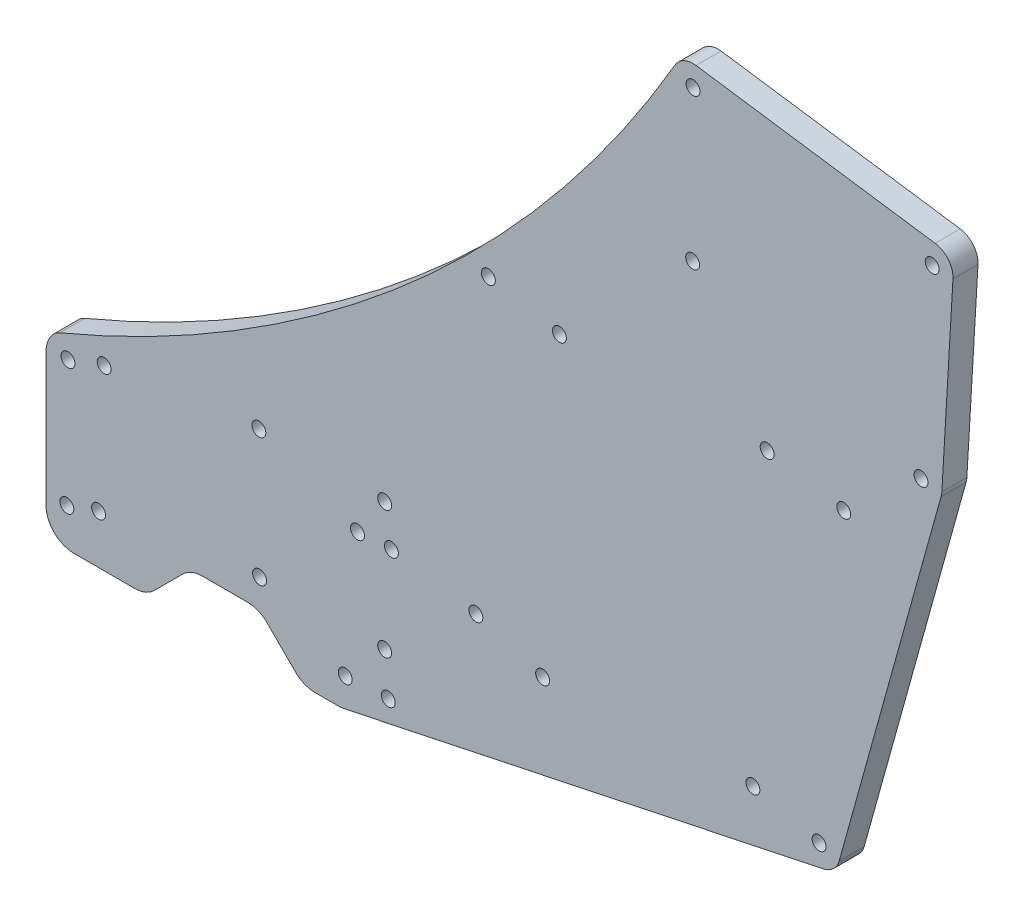
from build123d import *

# Parameters (mm, degrees)
SKETCH2_R           = 2.499965
SKETCH2_R_2         = 2.49997
SKETCH2_R_3         = 2.4999655
SKETCH2_R_4         = 2.499962807
SKETCH2_R_5         = 2.4999705
SKETCH2_R_6         = 2.499967809
SKETCH2_R_7         = 2.499966
SKETCH2_R_8         = 2.4999665
SKETCH2_R_9         = 2.499966488
BOSS_EXTRUDE1_DEPTH = 9
CUT_EXTRUDE1_DEPTH  = 10
CUT_EXTRUDE2_DEPTH  = 244.998875453
SKETCH5_R           = 2.5
CUT_EXTRUDE3_DEPTH  = 244.998875453
CUT_EXTRUDE5_DEPTH  = 10
FILLET1_R           = 10


with BuildPart() as part:
    # Sketch2 → Boss-Extrude1 (new body)
    with BuildSketch(Plane.XY):
        Polygon((-211.70586, -139.55845), (122.983766, -139.55845), (211.70583, 139.558464), (-211.70586, 139.558464), align=None)
        with Locations((-192.444718, -125.900476)):
            Circle(SKETCH2_R, mode=Mode.SUBTRACT)
        with Locations((-181.028235, -121.988219)):
            Circle(SKETCH2_R_2, mode=Mode.SUBTRACT)
        with Locations((-192.0409685, -80.3042345)):
            Circle(SKETCH2_R_3, mode=Mode.SUBTRACT)
        with Locations((-179.0281635, -75.623296193)):
            Circle(SKETCH2_R_4, mode=Mode.SUBTRACT)
        with Locations((-92.3000565, -128.9494755)):
            Circle(SKETCH2_R_5, mode=Mode.SUBTRACT)
        with Locations((-76.832143809, -128.336904809)):
            Circle(SKETCH2_R_6, mode=Mode.SUBTRACT)
        with Locations((-87.928392809, -81.863553809)):
            Circle(SKETCH2_R_6, mode=Mode.SUBTRACT)
        with Locations((-75.718345809, -81.250965809)):
            Circle(SKETCH2_R_6, mode=Mode.SUBTRACT)
        with Locations((-45.325502, -86.123854)):
            Circle(SKETCH2_R, mode=Mode.SUBTRACT)
        with Locations((-21.323083, -93.781229)):
            Circle(SKETCH2_R_7, mode=Mode.SUBTRACT)
        with Locations((54.304011, -89.994307)):
            Circle(SKETCH2_R_7, mode=Mode.SUBTRACT)
        with Locations((78.1115035, -95.7303835)):
            Circle(SKETCH2_R_8, mode=Mode.SUBTRACT)
        with Locations((114.776659, 36.09363)):
            Circle(SKETCH2_R, mode=Mode.SUBTRACT)
        with Locations((86.96623, 12.266557)):
            Circle(SKETCH2_R_7, mode=Mode.SUBTRACT)
        with Locations((59.4275, 17.097677)):
            Circle(SKETCH2_R, mode=Mode.SUBTRACT)
        with Locations((-40.842451, 21.163049)):
            Circle(SKETCH2_R, mode=Mode.SUBTRACT)
        with Locations((-15.2807135, 15.9838705)):
            Circle(SKETCH2_R_8, mode=Mode.SUBTRACT)
        with Locations((32.626661, 62.749598)):
            Circle(SKETCH2_R_7, mode=Mode.SUBTRACT)
        with Locations((118.780878488, 104.469667)):
            Circle(SKETCH2_R_9, mode=Mode.SUBTRACT)
        with Locations((32.7798015, 116.8664005)):
            Circle(SKETCH2_R_8, mode=Mode.SUBTRACT)
    extrude(amount=BOSS_EXTRUDE1_DEPTH)

    # Sketch3 → Cut-Extrude1 (cut)
    with BuildSketch(Plane.XY.offset(9)):
        Polygon((147.113293383, 124.3664005), (73.705987484, -139.55845), (211.70583, -139.55845), (211.70583, 139.558464), (-211.70586, 139.558464), (-211.70586, -139.55845), (-199.944718, -139.55845), (-199.944718, -77.260214262), (29.956914073, 124.3664005), align=None)
    extrude(amount=-CUT_EXTRUDE1_DEPTH, mode=Mode.SUBTRACT)

    # Sketch4 → Cut-Extrude2 (cut, through all)
    with BuildSketch(Plane.XY.offset(9)):
        Polygon((-163.885127, -139.55845), (-147.880898, -123.554221), (-123.333708966, -123.554221), (-107.329479966, -139.55845), align=None)
    extrude(amount=-CUT_EXTRUDE2_DEPTH, mode=Mode.SUBTRACT)

    # Sketch5 → Cut-Extrude3 (cut, through all)
    with BuildSketch(Plane.XY.offset(9)):
        with Locations((-123.130898, -113.554221)):
            Circle(SKETCH5_R)
        with Locations((-78.130898, -113.554221)):
            Circle(SKETCH5_R)
        with Locations((-123.380898, -67.554221)):
            Circle(SKETCH5_R)
        with Locations((-78.130898, -67.554221)):
            Circle(SKETCH5_R)
    extrude(amount=-CUT_EXTRUDE3_DEPTH, mode=Mode.SUBTRACT)

    # Sketch6 → Cut-Extrude5 (cut)
    with BuildSketch(Plane.XY.offset(9)):
        with BuildLine():
            Line((-195.525508542, -73.384512142), (-194.933621691, -73.384512142))
            ThreePointArc((-194.933621691, -73.384512142), (-115.656074248, -30.741284252), (-46.149790694, 26.462307945))
            ThreePointArc((-46.149790694, 26.462307945), (-6.887258575, 71.211725192), (26.296691523, 120.637247226))
            Line((26.296691523, 120.637247226), (26.296691523, 121.156339417))
            Line((26.296691523, 121.156339417), (-195.525508542, -73.384512142))
        make_face()
        Polygon((147.113293383, 35.655168177), (147.113293383, 124.3664005), (122.439403996, 35.655168177), align=None)
        Polygon((-75.287663516, -135.676154132), (-93.736030822, -139.55845), (73.705987484, -139.55845), (83.854883116, -103.069632849), (79.655983667, -103.069632849), align=None)
        with BuildLine():
            Line((79.655983667, -103.069632849), (83.854883116, -103.069632849))
            Line((83.854883116, -103.069632849), (85.337218021, -97.740122205))
            ThreePointArc((85.337218021, -97.740122205), (83.24278011, -101.200301265), (79.655983667, -103.069632849))
        make_face()
        with BuildLine():
            ThreePointArc((-196.986177186, -74.665536862), (-196.011897332, -73.941709513), (-194.933621691, -73.384512142))
            Line((-194.933621691, -73.384512142), (-195.525508542, -73.384512142))
            Line((-195.525508542, -73.384512142), (-196.986177186, -74.665536862))
        make_face()
        Polygon((26.296691523, 124.3664005), (26.296691523, 121.156339417), (27.834592626, 122.505097973), (29.956914073, 124.3664005), align=None)
        with BuildLine():
            Line((27.834592626, 122.505097973), (26.296691523, 121.156339417))
            Line((26.296691523, 121.156339417), (26.296691523, 120.637247226))
            ThreePointArc((26.296691523, 120.637247226), (26.989824424, 121.633597313), (27.834592626, 122.505097973))
        make_face()
        with BuildLine():
            Line((29.956914073, 124.3664005), (27.834592626, 122.505097973))
            ThreePointArc((27.834592626, 122.505097973), (30.137854408, 123.885667952), (32.779801516, 124.3664005))
            Line((32.779801516, 124.3664005), (29.956914073, 124.3664005))
        make_face()
        with BuildLine():
            Line((147.113293383, 124.3664005), (32.779801516, 124.3664005))
            ThreePointArc((32.779801516, 124.3664005), (33.31619378, 124.347194798), (33.849838899, 124.289676055))
            Line((33.849838899, 124.289676055), (119.850915887, 111.892942555))
            ThreePointArc((119.850915887, 111.892942555), (124.449885477, 109.380100764), (126.280878488, 104.469667))
            ThreePointArc((126.280878488, 104.469667), (126.277670913, 104.250342289), (126.268050933, 104.031205177))
            Line((126.268050933, 104.031205177), (122.263831446, 35.655168177))
            Line((122.263831446, 35.655168177), (122.439403996, 35.655168177))
            Line((122.439403996, 35.655168177), (147.113293383, 124.3664005))
        make_face()
        with BuildLine():
            Line((122.002373456, 34.083891063), (122.439403996, 35.655168177))
            Line((122.439403996, 35.655168177), (122.263831446, 35.655168177))
            ThreePointArc((122.263831446, 35.655168177), (122.174935028, 34.862568747), (122.002373456, 34.083891063))
        make_face()
    extrude(amount=-CUT_EXTRUDE5_DEPTH, mode=Mode.SUBTRACT)

    # Fillet1
    # the kernel refuses this fillet: 10 mm, written as the material it adds along each edge
    with BuildSketch(Plane(origin=(-147.880898, -123.554221, 9), x_dir=(1, 0, 0), z_dir=(0, 0, -1)), Plane(origin=(-123.333708966, -123.554221, 9), x_dir=(0.707106781186551, -0.7071067811865441, 0), z_dir=(0, 0, -1))) as fillet1_piece_1:
        with BuildLine():
            CenterArc((FILLET1_R * 0.414213562373, FILLET1_R), FILLET1_R, 225, 45)
            Line((-FILLET1_R * 0.292893218813, FILLET1_R * 0.292893218813), (0, 0))
            Line((0, 0), (FILLET1_R * 0.414213562373, 0))
        make_face()
    extrude(amount=9)
    # the kernel refuses this fillet: 10 mm, written as the material it takes off along each edge
    with BuildSketch(Plane(origin=(-199.944718, -77.260214262, 20.264688934), x_dir=(0, -1, 0), z_dir=(0, 0, -1))) as fillet1_2_piece_1:
        with BuildLine():
            CenterArc((4.505875574, -10), FILLET1_R, 90, 45.239414653)
            Line((-2.5946774, -2.958540814), (0, 0))
            Line((0, 0), (4.505875574, 0))
        make_face()
    extrude(amount=31.529377868, mode=Mode.SUBTRACT)
    with BuildSketch(Plane(origin=(-163.885127, -139.55845, 19.355339059), x_dir=(-1, 0, 0), z_dir=(0, 0, -1)), Plane(origin=(-107.329479966, -139.55845, 19.355339059), x_dir=(-0.707106781186551, 0.7071067811865441, 0), z_dir=(0, 0, -1))) as fillet1_2_piece_2:
        with BuildLine():
            CenterArc((FILLET1_R * 0.414213562373, FILLET1_R), FILLET1_R, 225, 45)
            Line((-FILLET1_R * 0.292893218813, FILLET1_R * 0.292893218813), (0, 0))
            Line((0, 0), (FILLET1_R * 0.414213562373, 0))
        make_face()
    extrude(amount=29.710678119, mode=Mode.SUBTRACT)
    with BuildSketch(Plane(origin=(-93.736030822, -139.55845, 11.602018692), x_dir=(-1, 0, 0), z_dir=(0, 0, -1))) as fillet1_2_piece_3:
        with BuildLine():
            CenterArc((FILLET1_R * 0.104080747675, FILLET1_R), FILLET1_R, 258.116013885, 11.883986115)
            Line((-FILLET1_R * 0.101849941288, FILLET1_R * 0.0214334200765), (0, 0))
            Line((0, 0), (FILLET1_R * 0.104080747675, 0))
        make_face()
    extrude(amount=14.204037384, mode=Mode.SUBTRACT)
    with BuildSketch(Plane(origin=(-199.944718, -139.55845, 34), x_dir=(1, 0, 0), z_dir=(0, 0, -1))) as fillet1_2_piece_4:
        with BuildLine():
            CenterArc((FILLET1_R, -FILLET1_R), FILLET1_R, 90, 90)
            Line((0, -FILLET1_R), (0, 0))
            Line((0, 0), (FILLET1_R, 0))
        make_face()
    extrude(amount=59, mode=Mode.SUBTRACT)


solid = part.part
